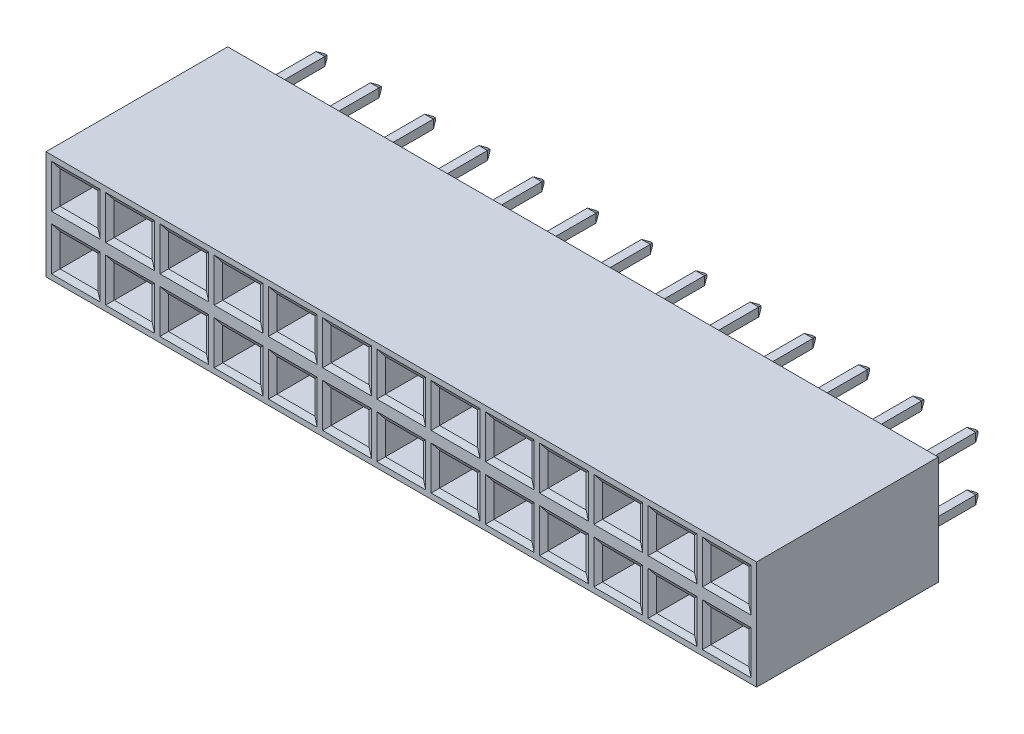
from build123d import *
from OCP.BRepFilletAPI import BRepFilletAPI_MakeChamfer

# Parameters (mm, degrees)
SKETCH1_W                   = 2.794
SKETCH1_H                   = 2.54
BOSS_EXTRUDE1_DEPTH         = 4.2545
SKETCH4_W                   = 1.778
SKETCH4_H                   = 1.524
CUT_EXTRUDE1_DEPTH          = 6.35
CHAMFER2_SIZE               = 0.254
CHAMFER2_SIZE2              = 0.146646968
SKETCH6_W                   = 0.4064
SKETCH6_H                   = 0.4064
BOSS_EXTRUDE2_DEPTH         = 3.2004
CHAMFER3_SIZE               = 0.254
CHAMFER3_SIZE2              = 0.146646968
LPATTERN1_COUNT             = 13
LPATTERN1_PITCH             = 2.54
LPATTERN1_COUNT_DIR2        = 2
LPATTERN1_PITCH_DIR2        = 2.54
CHAMFER2_OF_LPATTERN1_SIZE2 = 0.146646968
CHAMFER2_OF_LPATTERN1_SIZE  = 0.254
CHAMFER3_OF_LPATTERN1_SIZE  = 0.254
CHAMFER3_OF_LPATTERN1_SIZE2 = 0.146646968


with BuildPart() as part:
    # Sketch1 → Boss-Extrude1 (new, symmetric)
    with BuildSketch(Plane.XY):
        Rectangle(SKETCH1_W, SKETCH1_H)
    boss_extrude1 = extrude(amount=BOSS_EXTRUDE1_DEPTH, both=True)

    # Sketch4 → Cut-Extrude1 (cut)
    with BuildSketch(Plane.XY.offset(4.2545)):
        Rectangle(SKETCH4_W, SKETCH4_H)
    cut_extrude1 = extrude(amount=-CUT_EXTRUDE1_DEPTH, mode=Mode.SUBTRACT)

    # Chamfer2
    chamfer2_edges = [part.edges().sort_by_distance(p)[0] for p in [
        (-0.889, 0, 4.2545),
        (0, 0.762, 4.2545),
        (0.889, 0, 4.2545),
        (0, -0.762, 4.2545),
    ]]
    chamfer2_side = [part.faces().sort_by_distance(p)[0] for p in [
        (0, -1.232240185, 4.2545),
    ]]
    chamfer(chamfer2_edges, length=CHAMFER2_SIZE, length2=CHAMFER2_SIZE2, reference=chamfer2_side[0])

    # Sketch6 → Boss-Extrude2 (add)
    with BuildSketch(Plane(origin=(0, 0, -4.2545), x_dir=(-1, 0, 0), z_dir=(0, 0, -1))):
        Rectangle(SKETCH6_W, SKETCH6_H)
    boss_extrude2 = extrude(amount=BOSS_EXTRUDE2_DEPTH)

    # Chamfer3: one chamfer whose edges measure the first distance from different faces: ONE call of the kernel's chamfer builder (chamfer() names one face for all edges)
    chamfer3_edges_1 = [part.edges().sort_by_distance(p)[0] for p in [
        (0, -0.2032, -7.4549),
    ]]
    chamfer3_side_1 = [part.faces().sort_by_distance(p)[0] for p in [
        (0, -0.2032, -5.8547),
    ]]
    chamfer3_edges_2 = [part.edges().sort_by_distance(p)[0] for p in [
        (-0.2032, 0, -7.4549),
    ]]
    chamfer3_side_2 = [part.faces().sort_by_distance(p)[0] for p in [
        (-0.2032, 0, -5.8547),
    ]]
    chamfer3_edges_3 = [part.edges().sort_by_distance(p)[0] for p in [
        (0, 0.2032, -7.4549),
    ]]
    chamfer3_side_3 = [part.faces().sort_by_distance(p)[0] for p in [
        (0, 0.2032, -5.8547),
    ]]
    chamfer3_edges_4 = [part.edges().sort_by_distance(p)[0] for p in [
        (0.2032, 0, -7.4549),
    ]]
    chamfer3_side_4 = [part.faces().sort_by_distance(p)[0] for p in [
        (0.2032, 0, -5.8547),
    ]]
    chamfer3 = BRepFilletAPI_MakeChamfer(part.part.solid().wrapped)
    for e in chamfer3_edges_1:
        chamfer3.Add(CHAMFER3_SIZE, CHAMFER3_SIZE2, e.wrapped, chamfer3_side_1[0].wrapped)  # the first distance lies on this face
    for e in chamfer3_edges_2:
        chamfer3.Add(CHAMFER3_SIZE, CHAMFER3_SIZE2, e.wrapped, chamfer3_side_2[0].wrapped)  # the first distance lies on this face
    for e in chamfer3_edges_3:
        chamfer3.Add(CHAMFER3_SIZE, CHAMFER3_SIZE2, e.wrapped, chamfer3_side_3[0].wrapped)  # the first distance lies on this face
    for e in chamfer3_edges_4:
        chamfer3.Add(CHAMFER3_SIZE, CHAMFER3_SIZE2, e.wrapped, chamfer3_side_4[0].wrapped)  # the first distance lies on this face
    add(Compound.cast(chamfer3.Shape()), mode=Mode.REPLACE)

    # LPattern1: Boss-Extrude1, Cut-Extrude1, Boss-Extrude2 13 × 2
    with Locations(*[(i * LPATTERN1_PITCH, -j * LPATTERN1_PITCH_DIR2, 0) for i in range(LPATTERN1_COUNT) for j in range(LPATTERN1_COUNT_DIR2) if (i, j) != (0, 0)]):
        add(boss_extrude1)
        add(cut_extrude1, mode=Mode.SUBTRACT)
        add(boss_extrude2)

    # Chamfer2 of LPattern1
    chamfer2_of_lpattern1_edges = [part.edges().sort_by_distance(p)[0] for p in [
        (-0.889, -2.54, 4.2545),
        (0, -1.778, 4.2545),
        (0.889, -2.54, 4.2545),
        (0, -3.302, 4.2545),
        (1.651, 0, 4.2545),
        (2.54, 0.762, 4.2545),
        (3.429, 0, 4.2545),
        (2.54, -0.762, 4.2545),
        (1.651, -2.54, 4.2545),
        (2.54, -1.778, 4.2545),
        (3.429, -2.54, 4.2545),
        (2.54, -3.302, 4.2545),
        (4.191, 0, 4.2545),
        (5.08, 0.762, 4.2545),
        (5.969, 0, 4.2545),
        (5.08, -0.762, 4.2545),
        (4.191, -2.54, 4.2545),
        (5.08, -1.778, 4.2545),
        (5.969, -2.54, 4.2545),
        (5.08, -3.302, 4.2545),
        (6.731, 0, 4.2545),
        (7.62, 0.762, 4.2545),
        (8.509, 0, 4.2545),
        (7.62, -0.762, 4.2545),
        (6.731, -2.54, 4.2545),
        (7.62, -1.778, 4.2545),
        (8.509, -2.54, 4.2545),
        (7.62, -3.302, 4.2545),
        (9.271, 0, 4.2545),
        (10.16, 0.762, 4.2545),
        (11.049, 0, 4.2545),
        (10.16, -0.762, 4.2545),
        (9.271, -2.54, 4.2545),
        (10.16, -1.778, 4.2545),
        (11.049, -2.54, 4.2545),
        (10.16, -3.302, 4.2545),
        (11.811, 0, 4.2545),
        (12.7, 0.762, 4.2545),
        (13.589, 0, 4.2545),
        (12.7, -0.762, 4.2545),
        (11.811, -2.54, 4.2545),
        (12.7, -1.778, 4.2545),
        (13.589, -2.54, 4.2545),
        (12.7, -3.302, 4.2545),
        (14.351, 0, 4.2545),
        (15.24, 0.762, 4.2545),
        (16.129, 0, 4.2545),
        (15.24, -0.762, 4.2545),
        (14.351, -2.54, 4.2545),
        (15.24, -1.778, 4.2545),
        (16.129, -2.54, 4.2545),
        (15.24, -3.302, 4.2545),
        (16.891, 0, 4.2545),
        (17.78, 0.762, 4.2545),
        (18.669, 0, 4.2545),
        (17.78, -0.762, 4.2545),
        (16.891, -2.54, 4.2545),
        (17.78, -1.778, 4.2545),
        (18.669, -2.54, 4.2545),
        (17.78, -3.302, 4.2545),
        (19.431, 0, 4.2545),
        (20.32, 0.762, 4.2545),
        (21.209, 0, 4.2545),
        (20.32, -0.762, 4.2545),
        (19.431, -2.54, 4.2545),
        (20.32, -1.778, 4.2545),
        (21.209, -2.54, 4.2545),
        (20.32, -3.302, 4.2545),
        (21.971, 0, 4.2545),
        (22.86, 0.762, 4.2545),
        (23.749, 0, 4.2545),
        (22.86, -0.762, 4.2545),
        (21.971, -2.54, 4.2545),
        (22.86, -1.778, 4.2545),
        (23.749, -2.54, 4.2545),
        (22.86, -3.302, 4.2545),
        (24.511, 0, 4.2545),
        (25.4, 0.762, 4.2545),
        (26.289, 0, 4.2545),
        (25.4, -0.762, 4.2545),
        (24.511, -2.54, 4.2545),
        (25.4, -1.778, 4.2545),
        (26.289, -2.54, 4.2545),
        (25.4, -3.302, 4.2545),
        (27.051, 0, 4.2545),
        (27.94, 0.762, 4.2545),
        (28.829, 0, 4.2545),
        (27.94, -0.762, 4.2545),
        (27.051, -2.54, 4.2545),
        (27.94, -1.778, 4.2545),
        (28.829, -2.54, 4.2545),
        (27.94, -3.302, 4.2545),
        (29.591, 0, 4.2545),
        (30.48, 0.762, 4.2545),
        (31.369, 0, 4.2545),
        (30.48, -0.762, 4.2545),
        (29.591, -2.54, 4.2545),
        (30.48, -1.778, 4.2545),
        (31.369, -2.54, 4.2545),
        (30.48, -3.302, 4.2545),
    ]]
    chamfer(chamfer2_of_lpattern1_edges, length=CHAMFER2_OF_LPATTERN1_SIZE, length2=CHAMFER2_OF_LPATTERN1_SIZE2)

    # Chamfer3 of LPattern1: one chamfer whose edges measure the first distance from different faces: ONE call of the kernel's chamfer builder (chamfer() names one face for all edges)
    chamfer3_of_lpattern1_edges_1 = [part.edges().sort_by_distance(p)[0] for p in [
        (0, -2.7432, -7.4549),
    ]]
    chamfer3_of_lpattern1_side_1 = [part.faces().sort_by_distance(p)[0] for p in [
        (0, -2.7432, -5.8547),
    ]]
    chamfer3_of_lpattern1_edges_2 = [part.edges().sort_by_distance(p)[0] for p in [
        (-0.2032, -2.54, -7.4549),
    ]]
    chamfer3_of_lpattern1_side_2 = [part.faces().sort_by_distance(p)[0] for p in [
        (-0.2032, -2.54, -5.8547),
    ]]
    chamfer3_of_lpattern1_edges_3 = [part.edges().sort_by_distance(p)[0] for p in [
        (0, -2.3368, -7.4549),
    ]]
    chamfer3_of_lpattern1_side_3 = [part.faces().sort_by_distance(p)[0] for p in [
        (0, -2.3368, -5.8547),
    ]]
    chamfer3_of_lpattern1_edges_4 = [part.edges().sort_by_distance(p)[0] for p in [
        (0.2032, -2.54, -7.4549),
    ]]
    chamfer3_of_lpattern1_side_4 = [part.faces().sort_by_distance(p)[0] for p in [
        (0.2032, -2.54, -5.8547),
    ]]
    chamfer3_of_lpattern1_edges_5 = [part.edges().sort_by_distance(p)[0] for p in [
        (2.54, -0.2032, -7.4549),
    ]]
    chamfer3_of_lpattern1_side_5 = [part.faces().sort_by_distance(p)[0] for p in [
        (2.54, -0.2032, -5.8547),
    ]]
    chamfer3_of_lpattern1_edges_6 = [part.edges().sort_by_distance(p)[0] for p in [
        (2.3368, 0, -7.4549),
    ]]
    chamfer3_of_lpattern1_side_6 = [part.faces().sort_by_distance(p)[0] for p in [
        (2.3368, 0, -5.8547),
    ]]
    chamfer3_of_lpattern1_edges_7 = [part.edges().sort_by_distance(p)[0] for p in [
        (2.54, 0.2032, -7.4549),
    ]]
    chamfer3_of_lpattern1_side_7 = [part.faces().sort_by_distance(p)[0] for p in [
        (2.54, 0.2032, -5.8547),
    ]]
    chamfer3_of_lpattern1_edges_8 = [part.edges().sort_by_distance(p)[0] for p in [
        (2.7432, 0, -7.4549),
    ]]
    chamfer3_of_lpattern1_side_8 = [part.faces().sort_by_distance(p)[0] for p in [
        (2.7432, 0, -5.8547),
    ]]
    chamfer3_of_lpattern1_edges_9 = [part.edges().sort_by_distance(p)[0] for p in [
        (2.54, -2.7432, -7.4549),
    ]]
    chamfer3_of_lpattern1_side_9 = [part.faces().sort_by_distance(p)[0] for p in [
        (2.54, -2.7432, -5.8547),
    ]]
    chamfer3_of_lpattern1_edges_10 = [part.edges().sort_by_distance(p)[0] for p in [
        (2.3368, -2.54, -7.4549),
    ]]
    chamfer3_of_lpattern1_side_10 = [part.faces().sort_by_distance(p)[0] for p in [
        (2.3368, -2.54, -5.8547),
    ]]
    chamfer3_of_lpattern1_edges_11 = [part.edges().sort_by_distance(p)[0] for p in [
        (2.54, -2.3368, -7.4549),
    ]]
    chamfer3_of_lpattern1_side_11 = [part.faces().sort_by_distance(p)[0] for p in [
        (2.54, -2.3368, -5.8547),
    ]]
    chamfer3_of_lpattern1_edges_12 = [part.edges().sort_by_distance(p)[0] for p in [
        (2.7432, -2.54, -7.4549),
    ]]
    chamfer3_of_lpattern1_side_12 = [part.faces().sort_by_distance(p)[0] for p in [
        (2.7432, -2.54, -5.8547),
    ]]
    chamfer3_of_lpattern1_edges_13 = [part.edges().sort_by_distance(p)[0] for p in [
        (5.08, -0.2032, -7.4549),
    ]]
    chamfer3_of_lpattern1_side_13 = [part.faces().sort_by_distance(p)[0] for p in [
        (5.08, -0.2032, -5.8547),
    ]]
    chamfer3_of_lpattern1_edges_14 = [part.edges().sort_by_distance(p)[0] for p in [
        (4.8768, 0, -7.4549),
    ]]
    chamfer3_of_lpattern1_side_14 = [part.faces().sort_by_distance(p)[0] for p in [
        (4.8768, 0, -5.8547),
    ]]
    chamfer3_of_lpattern1_edges_15 = [part.edges().sort_by_distance(p)[0] for p in [
        (5.08, 0.2032, -7.4549),
    ]]
    chamfer3_of_lpattern1_side_15 = [part.faces().sort_by_distance(p)[0] for p in [
        (5.08, 0.2032, -5.8547),
    ]]
    chamfer3_of_lpattern1_edges_16 = [part.edges().sort_by_distance(p)[0] for p in [
        (5.2832, 0, -7.4549),
    ]]
    chamfer3_of_lpattern1_side_16 = [part.faces().sort_by_distance(p)[0] for p in [
        (5.2832, 0, -5.8547),
    ]]
    chamfer3_of_lpattern1_edges_17 = [part.edges().sort_by_distance(p)[0] for p in [
        (5.08, -2.7432, -7.4549),
    ]]
    chamfer3_of_lpattern1_side_17 = [part.faces().sort_by_distance(p)[0] for p in [
        (5.08, -2.7432, -5.8547),
    ]]
    chamfer3_of_lpattern1_edges_18 = [part.edges().sort_by_distance(p)[0] for p in [
        (4.8768, -2.54, -7.4549),
    ]]
    chamfer3_of_lpattern1_side_18 = [part.faces().sort_by_distance(p)[0] for p in [
        (4.8768, -2.54, -5.8547),
    ]]
    chamfer3_of_lpattern1_edges_19 = [part.edges().sort_by_distance(p)[0] for p in [
        (5.08, -2.3368, -7.4549),
    ]]
    chamfer3_of_lpattern1_side_19 = [part.faces().sort_by_distance(p)[0] for p in [
        (5.08, -2.3368, -5.8547),
    ]]
    chamfer3_of_lpattern1_edges_20 = [part.edges().sort_by_distance(p)[0] for p in [
        (5.2832, -2.54, -7.4549),
    ]]
    chamfer3_of_lpattern1_side_20 = [part.faces().sort_by_distance(p)[0] for p in [
        (5.2832, -2.54, -5.8547),
    ]]
    chamfer3_of_lpattern1_edges_21 = [part.edges().sort_by_distance(p)[0] for p in [
        (7.62, -0.2032, -7.4549),
    ]]
    chamfer3_of_lpattern1_side_21 = [part.faces().sort_by_distance(p)[0] for p in [
        (7.62, -0.2032, -5.8547),
    ]]
    chamfer3_of_lpattern1_edges_22 = [part.edges().sort_by_distance(p)[0] for p in [
        (7.4168, 0, -7.4549),
    ]]
    chamfer3_of_lpattern1_side_22 = [part.faces().sort_by_distance(p)[0] for p in [
        (7.4168, 0, -5.8547),
    ]]
    chamfer3_of_lpattern1_edges_23 = [part.edges().sort_by_distance(p)[0] for p in [
        (7.62, 0.2032, -7.4549),
    ]]
    chamfer3_of_lpattern1_side_23 = [part.faces().sort_by_distance(p)[0] for p in [
        (7.62, 0.2032, -5.8547),
    ]]
    chamfer3_of_lpattern1_edges_24 = [part.edges().sort_by_distance(p)[0] for p in [
        (7.8232, 0, -7.4549),
    ]]
    chamfer3_of_lpattern1_side_24 = [part.faces().sort_by_distance(p)[0] for p in [
        (7.8232, 0, -5.8547),
    ]]
    chamfer3_of_lpattern1_edges_25 = [part.edges().sort_by_distance(p)[0] for p in [
        (7.62, -2.7432, -7.4549),
    ]]
    chamfer3_of_lpattern1_side_25 = [part.faces().sort_by_distance(p)[0] for p in [
        (7.62, -2.7432, -5.8547),
    ]]
    chamfer3_of_lpattern1_edges_26 = [part.edges().sort_by_distance(p)[0] for p in [
        (7.4168, -2.54, -7.4549),
    ]]
    chamfer3_of_lpattern1_side_26 = [part.faces().sort_by_distance(p)[0] for p in [
        (7.4168, -2.54, -5.8547),
    ]]
    chamfer3_of_lpattern1_edges_27 = [part.edges().sort_by_distance(p)[0] for p in [
        (7.62, -2.3368, -7.4549),
    ]]
    chamfer3_of_lpattern1_side_27 = [part.faces().sort_by_distance(p)[0] for p in [
        (7.62, -2.3368, -5.8547),
    ]]
    chamfer3_of_lpattern1_edges_28 = [part.edges().sort_by_distance(p)[0] for p in [
        (7.8232, -2.54, -7.4549),
    ]]
    chamfer3_of_lpattern1_side_28 = [part.faces().sort_by_distance(p)[0] for p in [
        (7.8232, -2.54, -5.8547),
    ]]
    chamfer3_of_lpattern1_edges_29 = [part.edges().sort_by_distance(p)[0] for p in [
        (10.16, -0.2032, -7.4549),
    ]]
    chamfer3_of_lpattern1_side_29 = [part.faces().sort_by_distance(p)[0] for p in [
        (10.16, -0.2032, -5.8547),
    ]]
    chamfer3_of_lpattern1_edges_30 = [part.edges().sort_by_distance(p)[0] for p in [
        (9.9568, 0, -7.4549),
    ]]
    chamfer3_of_lpattern1_side_30 = [part.faces().sort_by_distance(p)[0] for p in [
        (9.9568, 0, -5.8547),
    ]]
    chamfer3_of_lpattern1_edges_31 = [part.edges().sort_by_distance(p)[0] for p in [
        (10.16, 0.2032, -7.4549),
    ]]
    chamfer3_of_lpattern1_side_31 = [part.faces().sort_by_distance(p)[0] for p in [
        (10.16, 0.2032, -5.8547),
    ]]
    chamfer3_of_lpattern1_edges_32 = [part.edges().sort_by_distance(p)[0] for p in [
        (10.3632, 0, -7.4549),
    ]]
    chamfer3_of_lpattern1_side_32 = [part.faces().sort_by_distance(p)[0] for p in [
        (10.3632, 0, -5.8547),
    ]]
    chamfer3_of_lpattern1_edges_33 = [part.edges().sort_by_distance(p)[0] for p in [
        (10.16, -2.7432, -7.4549),
    ]]
    chamfer3_of_lpattern1_side_33 = [part.faces().sort_by_distance(p)[0] for p in [
        (10.16, -2.7432, -5.8547),
    ]]
    chamfer3_of_lpattern1_edges_34 = [part.edges().sort_by_distance(p)[0] for p in [
        (9.9568, -2.54, -7.4549),
    ]]
    chamfer3_of_lpattern1_side_34 = [part.faces().sort_by_distance(p)[0] for p in [
        (9.9568, -2.54, -5.8547),
    ]]
    chamfer3_of_lpattern1_edges_35 = [part.edges().sort_by_distance(p)[0] for p in [
        (10.16, -2.3368, -7.4549),
    ]]
    chamfer3_of_lpattern1_side_35 = [part.faces().sort_by_distance(p)[0] for p in [
        (10.16, -2.3368, -5.8547),
    ]]
    chamfer3_of_lpattern1_edges_36 = [part.edges().sort_by_distance(p)[0] for p in [
        (10.3632, -2.54, -7.4549),
    ]]
    chamfer3_of_lpattern1_side_36 = [part.faces().sort_by_distance(p)[0] for p in [
        (10.3632, -2.54, -5.8547),
    ]]
    chamfer3_of_lpattern1_edges_37 = [part.edges().sort_by_distance(p)[0] for p in [
        (12.7, -0.2032, -7.4549),
    ]]
    chamfer3_of_lpattern1_side_37 = [part.faces().sort_by_distance(p)[0] for p in [
        (12.7, -0.2032, -5.8547),
    ]]
    chamfer3_of_lpattern1_edges_38 = [part.edges().sort_by_distance(p)[0] for p in [
        (12.4968, 0, -7.4549),
    ]]
    chamfer3_of_lpattern1_side_38 = [part.faces().sort_by_distance(p)[0] for p in [
        (12.4968, 0, -5.8547),
    ]]
    chamfer3_of_lpattern1_edges_39 = [part.edges().sort_by_distance(p)[0] for p in [
        (12.7, 0.2032, -7.4549),
    ]]
    chamfer3_of_lpattern1_side_39 = [part.faces().sort_by_distance(p)[0] for p in [
        (12.7, 0.2032, -5.8547),
    ]]
    chamfer3_of_lpattern1_edges_40 = [part.edges().sort_by_distance(p)[0] for p in [
        (12.9032, 0, -7.4549),
    ]]
    chamfer3_of_lpattern1_side_40 = [part.faces().sort_by_distance(p)[0] for p in [
        (12.9032, 0, -5.8547),
    ]]
    chamfer3_of_lpattern1_edges_41 = [part.edges().sort_by_distance(p)[0] for p in [
        (12.7, -2.7432, -7.4549),
    ]]
    chamfer3_of_lpattern1_side_41 = [part.faces().sort_by_distance(p)[0] for p in [
        (12.7, -2.7432, -5.8547),
    ]]
    chamfer3_of_lpattern1_edges_42 = [part.edges().sort_by_distance(p)[0] for p in [
        (12.4968, -2.54, -7.4549),
    ]]
    chamfer3_of_lpattern1_side_42 = [part.faces().sort_by_distance(p)[0] for p in [
        (12.4968, -2.54, -5.8547),
    ]]
    chamfer3_of_lpattern1_edges_43 = [part.edges().sort_by_distance(p)[0] for p in [
        (12.7, -2.3368, -7.4549),
    ]]
    chamfer3_of_lpattern1_side_43 = [part.faces().sort_by_distance(p)[0] for p in [
        (12.7, -2.3368, -5.8547),
    ]]
    chamfer3_of_lpattern1_edges_44 = [part.edges().sort_by_distance(p)[0] for p in [
        (12.9032, -2.54, -7.4549),
    ]]
    chamfer3_of_lpattern1_side_44 = [part.faces().sort_by_distance(p)[0] for p in [
        (12.9032, -2.54, -5.8547),
    ]]
    chamfer3_of_lpattern1_edges_45 = [part.edges().sort_by_distance(p)[0] for p in [
        (15.24, -0.2032, -7.4549),
    ]]
    chamfer3_of_lpattern1_side_45 = [part.faces().sort_by_distance(p)[0] for p in [
        (15.24, -0.2032, -5.8547),
    ]]
    chamfer3_of_lpattern1_edges_46 = [part.edges().sort_by_distance(p)[0] for p in [
        (15.0368, 0, -7.4549),
    ]]
    chamfer3_of_lpattern1_side_46 = [part.faces().sort_by_distance(p)[0] for p in [
        (15.0368, 0, -5.8547),
    ]]
    chamfer3_of_lpattern1_edges_47 = [part.edges().sort_by_distance(p)[0] for p in [
        (15.24, 0.2032, -7.4549),
    ]]
    chamfer3_of_lpattern1_side_47 = [part.faces().sort_by_distance(p)[0] for p in [
        (15.24, 0.2032, -5.8547),
    ]]
    chamfer3_of_lpattern1_edges_48 = [part.edges().sort_by_distance(p)[0] for p in [
        (15.4432, 0, -7.4549),
    ]]
    chamfer3_of_lpattern1_side_48 = [part.faces().sort_by_distance(p)[0] for p in [
        (15.4432, 0, -5.8547),
    ]]
    chamfer3_of_lpattern1_edges_49 = [part.edges().sort_by_distance(p)[0] for p in [
        (15.24, -2.7432, -7.4549),
    ]]
    chamfer3_of_lpattern1_side_49 = [part.faces().sort_by_distance(p)[0] for p in [
        (15.24, -2.7432, -5.8547),
    ]]
    chamfer3_of_lpattern1_edges_50 = [part.edges().sort_by_distance(p)[0] for p in [
        (15.0368, -2.54, -7.4549),
    ]]
    chamfer3_of_lpattern1_side_50 = [part.faces().sort_by_distance(p)[0] for p in [
        (15.0368, -2.54, -5.8547),
    ]]
    chamfer3_of_lpattern1_edges_51 = [part.edges().sort_by_distance(p)[0] for p in [
        (15.24, -2.3368, -7.4549),
    ]]
    chamfer3_of_lpattern1_side_51 = [part.faces().sort_by_distance(p)[0] for p in [
        (15.24, -2.3368, -5.8547),
    ]]
    chamfer3_of_lpattern1_edges_52 = [part.edges().sort_by_distance(p)[0] for p in [
        (15.4432, -2.54, -7.4549),
    ]]
    chamfer3_of_lpattern1_side_52 = [part.faces().sort_by_distance(p)[0] for p in [
        (15.4432, -2.54, -5.8547),
    ]]
    chamfer3_of_lpattern1_edges_53 = [part.edges().sort_by_distance(p)[0] for p in [
        (17.78, -0.2032, -7.4549),
    ]]
    chamfer3_of_lpattern1_side_53 = [part.faces().sort_by_distance(p)[0] for p in [
        (17.78, -0.2032, -5.8547),
    ]]
    chamfer3_of_lpattern1_edges_54 = [part.edges().sort_by_distance(p)[0] for p in [
        (17.5768, 0, -7.4549),
    ]]
    chamfer3_of_lpattern1_side_54 = [part.faces().sort_by_distance(p)[0] for p in [
        (17.5768, 0, -5.8547),
    ]]
    chamfer3_of_lpattern1_edges_55 = [part.edges().sort_by_distance(p)[0] for p in [
        (17.78, 0.2032, -7.4549),
    ]]
    chamfer3_of_lpattern1_side_55 = [part.faces().sort_by_distance(p)[0] for p in [
        (17.78, 0.2032, -5.8547),
    ]]
    chamfer3_of_lpattern1_edges_56 = [part.edges().sort_by_distance(p)[0] for p in [
        (17.9832, 0, -7.4549),
    ]]
    chamfer3_of_lpattern1_side_56 = [part.faces().sort_by_distance(p)[0] for p in [
        (17.9832, 0, -5.8547),
    ]]
    chamfer3_of_lpattern1_edges_57 = [part.edges().sort_by_distance(p)[0] for p in [
        (17.78, -2.7432, -7.4549),
    ]]
    chamfer3_of_lpattern1_side_57 = [part.faces().sort_by_distance(p)[0] for p in [
        (17.78, -2.7432, -5.8547),
    ]]
    chamfer3_of_lpattern1_edges_58 = [part.edges().sort_by_distance(p)[0] for p in [
        (17.5768, -2.54, -7.4549),
    ]]
    chamfer3_of_lpattern1_side_58 = [part.faces().sort_by_distance(p)[0] for p in [
        (17.5768, -2.54, -5.8547),
    ]]
    chamfer3_of_lpattern1_edges_59 = [part.edges().sort_by_distance(p)[0] for p in [
        (17.78, -2.3368, -7.4549),
    ]]
    chamfer3_of_lpattern1_side_59 = [part.faces().sort_by_distance(p)[0] for p in [
        (17.78, -2.3368, -5.8547),
    ]]
    chamfer3_of_lpattern1_edges_60 = [part.edges().sort_by_distance(p)[0] for p in [
        (17.9832, -2.54, -7.4549),
    ]]
    chamfer3_of_lpattern1_side_60 = [part.faces().sort_by_distance(p)[0] for p in [
        (17.9832, -2.54, -5.8547),
    ]]
    chamfer3_of_lpattern1_edges_61 = [part.edges().sort_by_distance(p)[0] for p in [
        (20.32, -0.2032, -7.4549),
    ]]
    chamfer3_of_lpattern1_side_61 = [part.faces().sort_by_distance(p)[0] for p in [
        (20.32, -0.2032, -5.8547),
    ]]
    chamfer3_of_lpattern1_edges_62 = [part.edges().sort_by_distance(p)[0] for p in [
        (20.1168, 0, -7.4549),
    ]]
    chamfer3_of_lpattern1_side_62 = [part.faces().sort_by_distance(p)[0] for p in [
        (20.1168, 0, -5.8547),
    ]]
    chamfer3_of_lpattern1_edges_63 = [part.edges().sort_by_distance(p)[0] for p in [
        (20.32, 0.2032, -7.4549),
    ]]
    chamfer3_of_lpattern1_side_63 = [part.faces().sort_by_distance(p)[0] for p in [
        (20.32, 0.2032, -5.8547),
    ]]
    chamfer3_of_lpattern1_edges_64 = [part.edges().sort_by_distance(p)[0] for p in [
        (20.5232, 0, -7.4549),
    ]]
    chamfer3_of_lpattern1_side_64 = [part.faces().sort_by_distance(p)[0] for p in [
        (20.5232, 0, -5.8547),
    ]]
    chamfer3_of_lpattern1_edges_65 = [part.edges().sort_by_distance(p)[0] for p in [
        (20.32, -2.7432, -7.4549),
    ]]
    chamfer3_of_lpattern1_side_65 = [part.faces().sort_by_distance(p)[0] for p in [
        (20.32, -2.7432, -5.8547),
    ]]
    chamfer3_of_lpattern1_edges_66 = [part.edges().sort_by_distance(p)[0] for p in [
        (20.1168, -2.54, -7.4549),
    ]]
    chamfer3_of_lpattern1_side_66 = [part.faces().sort_by_distance(p)[0] for p in [
        (20.1168, -2.54, -5.8547),
    ]]
    chamfer3_of_lpattern1_edges_67 = [part.edges().sort_by_distance(p)[0] for p in [
        (20.32, -2.3368, -7.4549),
    ]]
    chamfer3_of_lpattern1_side_67 = [part.faces().sort_by_distance(p)[0] for p in [
        (20.32, -2.3368, -5.8547),
    ]]
    chamfer3_of_lpattern1_edges_68 = [part.edges().sort_by_distance(p)[0] for p in [
        (20.5232, -2.54, -7.4549),
    ]]
    chamfer3_of_lpattern1_side_68 = [part.faces().sort_by_distance(p)[0] for p in [
        (20.5232, -2.54, -5.8547),
    ]]
    chamfer3_of_lpattern1_edges_69 = [part.edges().sort_by_distance(p)[0] for p in [
        (22.86, -0.2032, -7.4549),
    ]]
    chamfer3_of_lpattern1_side_69 = [part.faces().sort_by_distance(p)[0] for p in [
        (22.86, -0.2032, -5.8547),
    ]]
    chamfer3_of_lpattern1_edges_70 = [part.edges().sort_by_distance(p)[0] for p in [
        (22.6568, 0, -7.4549),
    ]]
    chamfer3_of_lpattern1_side_70 = [part.faces().sort_by_distance(p)[0] for p in [
        (22.6568, 0, -5.8547),
    ]]
    chamfer3_of_lpattern1_edges_71 = [part.edges().sort_by_distance(p)[0] for p in [
        (22.86, 0.2032, -7.4549),
    ]]
    chamfer3_of_lpattern1_side_71 = [part.faces().sort_by_distance(p)[0] for p in [
        (22.86, 0.2032, -5.8547),
    ]]
    chamfer3_of_lpattern1_edges_72 = [part.edges().sort_by_distance(p)[0] for p in [
        (23.0632, 0, -7.4549),
    ]]
    chamfer3_of_lpattern1_side_72 = [part.faces().sort_by_distance(p)[0] for p in [
        (23.0632, 0, -5.8547),
    ]]
    chamfer3_of_lpattern1_edges_73 = [part.edges().sort_by_distance(p)[0] for p in [
        (22.86, -2.7432, -7.4549),
    ]]
    chamfer3_of_lpattern1_side_73 = [part.faces().sort_by_distance(p)[0] for p in [
        (22.86, -2.7432, -5.8547),
    ]]
    chamfer3_of_lpattern1_edges_74 = [part.edges().sort_by_distance(p)[0] for p in [
        (22.6568, -2.54, -7.4549),
    ]]
    chamfer3_of_lpattern1_side_74 = [part.faces().sort_by_distance(p)[0] for p in [
        (22.6568, -2.54, -5.8547),
    ]]
    chamfer3_of_lpattern1_edges_75 = [part.edges().sort_by_distance(p)[0] for p in [
        (22.86, -2.3368, -7.4549),
    ]]
    chamfer3_of_lpattern1_side_75 = [part.faces().sort_by_distance(p)[0] for p in [
        (22.86, -2.3368, -5.8547),
    ]]
    chamfer3_of_lpattern1_edges_76 = [part.edges().sort_by_distance(p)[0] for p in [
        (23.0632, -2.54, -7.4549),
    ]]
    chamfer3_of_lpattern1_side_76 = [part.faces().sort_by_distance(p)[0] for p in [
        (23.0632, -2.54, -5.8547),
    ]]
    chamfer3_of_lpattern1_edges_77 = [part.edges().sort_by_distance(p)[0] for p in [
        (25.4, -0.2032, -7.4549),
    ]]
    chamfer3_of_lpattern1_side_77 = [part.faces().sort_by_distance(p)[0] for p in [
        (25.4, -0.2032, -5.8547),
    ]]
    chamfer3_of_lpattern1_edges_78 = [part.edges().sort_by_distance(p)[0] for p in [
        (25.1968, 0, -7.4549),
    ]]
    chamfer3_of_lpattern1_side_78 = [part.faces().sort_by_distance(p)[0] for p in [
        (25.1968, 0, -5.8547),
    ]]
    chamfer3_of_lpattern1_edges_79 = [part.edges().sort_by_distance(p)[0] for p in [
        (25.4, 0.2032, -7.4549),
    ]]
    chamfer3_of_lpattern1_side_79 = [part.faces().sort_by_distance(p)[0] for p in [
        (25.4, 0.2032, -5.8547),
    ]]
    chamfer3_of_lpattern1_edges_80 = [part.edges().sort_by_distance(p)[0] for p in [
        (25.6032, 0, -7.4549),
    ]]
    chamfer3_of_lpattern1_side_80 = [part.faces().sort_by_distance(p)[0] for p in [
        (25.6032, 0, -5.8547),
    ]]
    chamfer3_of_lpattern1_edges_81 = [part.edges().sort_by_distance(p)[0] for p in [
        (25.4, -2.7432, -7.4549),
    ]]
    chamfer3_of_lpattern1_side_81 = [part.faces().sort_by_distance(p)[0] for p in [
        (25.4, -2.7432, -5.8547),
    ]]
    chamfer3_of_lpattern1_edges_82 = [part.edges().sort_by_distance(p)[0] for p in [
        (25.1968, -2.54, -7.4549),
    ]]
    chamfer3_of_lpattern1_side_82 = [part.faces().sort_by_distance(p)[0] for p in [
        (25.1968, -2.54, -5.8547),
    ]]
    chamfer3_of_lpattern1_edges_83 = [part.edges().sort_by_distance(p)[0] for p in [
        (25.4, -2.3368, -7.4549),
    ]]
    chamfer3_of_lpattern1_side_83 = [part.faces().sort_by_distance(p)[0] for p in [
        (25.4, -2.3368, -5.8547),
    ]]
    chamfer3_of_lpattern1_edges_84 = [part.edges().sort_by_distance(p)[0] for p in [
        (25.6032, -2.54, -7.4549),
    ]]
    chamfer3_of_lpattern1_side_84 = [part.faces().sort_by_distance(p)[0] for p in [
        (25.6032, -2.54, -5.8547),
    ]]
    chamfer3_of_lpattern1_edges_85 = [part.edges().sort_by_distance(p)[0] for p in [
        (27.94, -0.2032, -7.4549),
    ]]
    chamfer3_of_lpattern1_side_85 = [part.faces().sort_by_distance(p)[0] for p in [
        (27.94, -0.2032, -5.8547),
    ]]
    chamfer3_of_lpattern1_edges_86 = [part.edges().sort_by_distance(p)[0] for p in [
        (27.7368, 0, -7.4549),
    ]]
    chamfer3_of_lpattern1_side_86 = [part.faces().sort_by_distance(p)[0] for p in [
        (27.7368, 0, -5.8547),
    ]]
    chamfer3_of_lpattern1_edges_87 = [part.edges().sort_by_distance(p)[0] for p in [
        (27.94, 0.2032, -7.4549),
    ]]
    chamfer3_of_lpattern1_side_87 = [part.faces().sort_by_distance(p)[0] for p in [
        (27.94, 0.2032, -5.8547),
    ]]
    chamfer3_of_lpattern1_edges_88 = [part.edges().sort_by_distance(p)[0] for p in [
        (28.1432, 0, -7.4549),
    ]]
    chamfer3_of_lpattern1_side_88 = [part.faces().sort_by_distance(p)[0] for p in [
        (28.1432, 0, -5.8547),
    ]]
    chamfer3_of_lpattern1_edges_89 = [part.edges().sort_by_distance(p)[0] for p in [
        (27.94, -2.7432, -7.4549),
    ]]
    chamfer3_of_lpattern1_side_89 = [part.faces().sort_by_distance(p)[0] for p in [
        (27.94, -2.7432, -5.8547),
    ]]
    chamfer3_of_lpattern1_edges_90 = [part.edges().sort_by_distance(p)[0] for p in [
        (27.7368, -2.54, -7.4549),
    ]]
    chamfer3_of_lpattern1_side_90 = [part.faces().sort_by_distance(p)[0] for p in [
        (27.7368, -2.54, -5.8547),
    ]]
    chamfer3_of_lpattern1_edges_91 = [part.edges().sort_by_distance(p)[0] for p in [
        (27.94, -2.3368, -7.4549),
    ]]
    chamfer3_of_lpattern1_side_91 = [part.faces().sort_by_distance(p)[0] for p in [
        (27.94, -2.3368, -5.8547),
    ]]
    chamfer3_of_lpattern1_edges_92 = [part.edges().sort_by_distance(p)[0] for p in [
        (28.1432, -2.54, -7.4549),
    ]]
    chamfer3_of_lpattern1_side_92 = [part.faces().sort_by_distance(p)[0] for p in [
        (28.1432, -2.54, -5.8547),
    ]]
    chamfer3_of_lpattern1_edges_93 = [part.edges().sort_by_distance(p)[0] for p in [
        (30.48, -0.2032, -7.4549),
    ]]
    chamfer3_of_lpattern1_side_93 = [part.faces().sort_by_distance(p)[0] for p in [
        (30.48, -0.2032, -5.8547),
    ]]
    chamfer3_of_lpattern1_edges_94 = [part.edges().sort_by_distance(p)[0] for p in [
        (30.2768, 0, -7.4549),
    ]]
    chamfer3_of_lpattern1_side_94 = [part.faces().sort_by_distance(p)[0] for p in [
        (30.2768, 0, -5.8547),
    ]]
    chamfer3_of_lpattern1_edges_95 = [part.edges().sort_by_distance(p)[0] for p in [
        (30.48, 0.2032, -7.4549),
    ]]
    chamfer3_of_lpattern1_side_95 = [part.faces().sort_by_distance(p)[0] for p in [
        (30.48, 0.2032, -5.8547),
    ]]
    chamfer3_of_lpattern1_edges_96 = [part.edges().sort_by_distance(p)[0] for p in [
        (30.6832, 0, -7.4549),
    ]]
    chamfer3_of_lpattern1_side_96 = [part.faces().sort_by_distance(p)[0] for p in [
        (30.6832, 0, -5.8547),
    ]]
    chamfer3_of_lpattern1_edges_97 = [part.edges().sort_by_distance(p)[0] for p in [
        (30.48, -2.7432, -7.4549),
    ]]
    chamfer3_of_lpattern1_side_97 = [part.faces().sort_by_distance(p)[0] for p in [
        (30.48, -2.7432, -5.8547),
    ]]
    chamfer3_of_lpattern1_edges_98 = [part.edges().sort_by_distance(p)[0] for p in [
        (30.2768, -2.54, -7.4549),
    ]]
    chamfer3_of_lpattern1_side_98 = [part.faces().sort_by_distance(p)[0] for p in [
        (30.2768, -2.54, -5.8547),
    ]]
    chamfer3_of_lpattern1_edges_99 = [part.edges().sort_by_distance(p)[0] for p in [
        (30.48, -2.3368, -7.4549),
    ]]
    chamfer3_of_lpattern1_side_99 = [part.faces().sort_by_distance(p)[0] for p in [
        (30.48, -2.3368, -5.8547),
    ]]
    chamfer3_of_lpattern1_edges_100 = [part.edges().sort_by_distance(p)[0] for p in [
        (30.6832, -2.54, -7.4549),
    ]]
    chamfer3_of_lpattern1_side_100 = [part.faces().sort_by_distance(p)[0] for p in [
        (30.6832, -2.54, -5.8547),
    ]]
    chamfer3_of_lpattern1 = BRepFilletAPI_MakeChamfer(part.part.solid().wrapped)
    for e in chamfer3_of_lpattern1_edges_1:
        chamfer3_of_lpattern1.Add(CHAMFER3_OF_LPATTERN1_SIZE, CHAMFER3_OF_LPATTERN1_SIZE2, e.wrapped, chamfer3_of_lpattern1_side_1[0].wrapped)  # the first distance lies on this face
    for e in chamfer3_of_lpattern1_edges_2:
        chamfer3_of_lpattern1.Add(CHAMFER3_OF_LPATTERN1_SIZE, CHAMFER3_OF_LPATTERN1_SIZE2, e.wrapped, chamfer3_of_lpattern1_side_2[0].wrapped)  # the first distance lies on this face
    for e in chamfer3_of_lpattern1_edges_3:
        chamfer3_of_lpattern1.Add(CHAMFER3_OF_LPATTERN1_SIZE, CHAMFER3_OF_LPATTERN1_SIZE2, e.wrapped, chamfer3_of_lpattern1_side_3[0].wrapped)  # the first distance lies on this face
    for e in chamfer3_of_lpattern1_edges_4:
        chamfer3_of_lpattern1.Add(CHAMFER3_OF_LPATTERN1_SIZE, CHAMFER3_OF_LPATTERN1_SIZE2, e.wrapped, chamfer3_of_lpattern1_side_4[0].wrapped)  # the first distance lies on this face
    for e in chamfer3_of_lpattern1_edges_5:
        chamfer3_of_lpattern1.Add(CHAMFER3_OF_LPATTERN1_SIZE, CHAMFER3_OF_LPATTERN1_SIZE2, e.wrapped, chamfer3_of_lpattern1_side_5[0].wrapped)  # the first distance lies on this face
    for e in chamfer3_of_lpattern1_edges_6:
        chamfer3_of_lpattern1.Add(CHAMFER3_OF_LPATTERN1_SIZE, CHAMFER3_OF_LPATTERN1_SIZE2, e.wrapped, chamfer3_of_lpattern1_side_6[0].wrapped)  # the first distance lies on this face
    for e in chamfer3_of_lpattern1_edges_7:
        chamfer3_of_lpattern1.Add(CHAMFER3_OF_LPATTERN1_SIZE, CHAMFER3_OF_LPATTERN1_SIZE2, e.wrapped, chamfer3_of_lpattern1_side_7[0].wrapped)  # the first distance lies on this face
    for e in chamfer3_of_lpattern1_edges_8:
        chamfer3_of_lpattern1.Add(CHAMFER3_OF_LPATTERN1_SIZE, CHAMFER3_OF_LPATTERN1_SIZE2, e.wrapped, chamfer3_of_lpattern1_side_8[0].wrapped)  # the first distance lies on this face
    for e in chamfer3_of_lpattern1_edges_9:
        chamfer3_of_lpattern1.Add(CHAMFER3_OF_LPATTERN1_SIZE, CHAMFER3_OF_LPATTERN1_SIZE2, e.wrapped, chamfer3_of_lpattern1_side_9[0].wrapped)  # the first distance lies on this face
    for e in chamfer3_of_lpattern1_edges_10:
        chamfer3_of_lpattern1.Add(CHAMFER3_OF_LPATTERN1_SIZE, CHAMFER3_OF_LPATTERN1_SIZE2, e.wrapped, chamfer3_of_lpattern1_side_10[0].wrapped)  # the first distance lies on this face
    for e in chamfer3_of_lpattern1_edges_11:
        chamfer3_of_lpattern1.Add(CHAMFER3_OF_LPATTERN1_SIZE, CHAMFER3_OF_LPATTERN1_SIZE2, e.wrapped, chamfer3_of_lpattern1_side_11[0].wrapped)  # the first distance lies on this face
    for e in chamfer3_of_lpattern1_edges_12:
        chamfer3_of_lpattern1.Add(CHAMFER3_OF_LPATTERN1_SIZE, CHAMFER3_OF_LPATTERN1_SIZE2, e.wrapped, chamfer3_of_lpattern1_side_12[0].wrapped)  # the first distance lies on this face
    for e in chamfer3_of_lpattern1_edges_13:
        chamfer3_of_lpattern1.Add(CHAMFER3_OF_LPATTERN1_SIZE, CHAMFER3_OF_LPATTERN1_SIZE2, e.wrapped, chamfer3_of_lpattern1_side_13[0].wrapped)  # the first distance lies on this face
    for e in chamfer3_of_lpattern1_edges_14:
        chamfer3_of_lpattern1.Add(CHAMFER3_OF_LPATTERN1_SIZE, CHAMFER3_OF_LPATTERN1_SIZE2, e.wrapped, chamfer3_of_lpattern1_side_14[0].wrapped)  # the first distance lies on this face
    for e in chamfer3_of_lpattern1_edges_15:
        chamfer3_of_lpattern1.Add(CHAMFER3_OF_LPATTERN1_SIZE, CHAMFER3_OF_LPATTERN1_SIZE2, e.wrapped, chamfer3_of_lpattern1_side_15[0].wrapped)  # the first distance lies on this face
    for e in chamfer3_of_lpattern1_edges_16:
        chamfer3_of_lpattern1.Add(CHAMFER3_OF_LPATTERN1_SIZE, CHAMFER3_OF_LPATTERN1_SIZE2, e.wrapped, chamfer3_of_lpattern1_side_16[0].wrapped)  # the first distance lies on this face
    for e in chamfer3_of_lpattern1_edges_17:
        chamfer3_of_lpattern1.Add(CHAMFER3_OF_LPATTERN1_SIZE, CHAMFER3_OF_LPATTERN1_SIZE2, e.wrapped, chamfer3_of_lpattern1_side_17[0].wrapped)  # the first distance lies on this face
    for e in chamfer3_of_lpattern1_edges_18:
        chamfer3_of_lpattern1.Add(CHAMFER3_OF_LPATTERN1_SIZE, CHAMFER3_OF_LPATTERN1_SIZE2, e.wrapped, chamfer3_of_lpattern1_side_18[0].wrapped)  # the first distance lies on this face
    for e in chamfer3_of_lpattern1_edges_19:
        chamfer3_of_lpattern1.Add(CHAMFER3_OF_LPATTERN1_SIZE, CHAMFER3_OF_LPATTERN1_SIZE2, e.wrapped, chamfer3_of_lpattern1_side_19[0].wrapped)  # the first distance lies on this face
    for e in chamfer3_of_lpattern1_edges_20:
        chamfer3_of_lpattern1.Add(CHAMFER3_OF_LPATTERN1_SIZE, CHAMFER3_OF_LPATTERN1_SIZE2, e.wrapped, chamfer3_of_lpattern1_side_20[0].wrapped)  # the first distance lies on this face
    for e in chamfer3_of_lpattern1_edges_21:
        chamfer3_of_lpattern1.Add(CHAMFER3_OF_LPATTERN1_SIZE, CHAMFER3_OF_LPATTERN1_SIZE2, e.wrapped, chamfer3_of_lpattern1_side_21[0].wrapped)  # the first distance lies on this face
    for e in chamfer3_of_lpattern1_edges_22:
        chamfer3_of_lpattern1.Add(CHAMFER3_OF_LPATTERN1_SIZE, CHAMFER3_OF_LPATTERN1_SIZE2, e.wrapped, chamfer3_of_lpattern1_side_22[0].wrapped)  # the first distance lies on this face
    for e in chamfer3_of_lpattern1_edges_23:
        chamfer3_of_lpattern1.Add(CHAMFER3_OF_LPATTERN1_SIZE, CHAMFER3_OF_LPATTERN1_SIZE2, e.wrapped, chamfer3_of_lpattern1_side_23[0].wrapped)  # the first distance lies on this face
    for e in chamfer3_of_lpattern1_edges_24:
        chamfer3_of_lpattern1.Add(CHAMFER3_OF_LPATTERN1_SIZE, CHAMFER3_OF_LPATTERN1_SIZE2, e.wrapped, chamfer3_of_lpattern1_side_24[0].wrapped)  # the first distance lies on this face
    for e in chamfer3_of_lpattern1_edges_25:
        chamfer3_of_lpattern1.Add(CHAMFER3_OF_LPATTERN1_SIZE, CHAMFER3_OF_LPATTERN1_SIZE2, e.wrapped, chamfer3_of_lpattern1_side_25[0].wrapped)  # the first distance lies on this face
    for e in chamfer3_of_lpattern1_edges_26:
        chamfer3_of_lpattern1.Add(CHAMFER3_OF_LPATTERN1_SIZE, CHAMFER3_OF_LPATTERN1_SIZE2, e.wrapped, chamfer3_of_lpattern1_side_26[0].wrapped)  # the first distance lies on this face
    for e in chamfer3_of_lpattern1_edges_27:
        chamfer3_of_lpattern1.Add(CHAMFER3_OF_LPATTERN1_SIZE, CHAMFER3_OF_LPATTERN1_SIZE2, e.wrapped, chamfer3_of_lpattern1_side_27[0].wrapped)  # the first distance lies on this face
    for e in chamfer3_of_lpattern1_edges_28:
        chamfer3_of_lpattern1.Add(CHAMFER3_OF_LPATTERN1_SIZE, CHAMFER3_OF_LPATTERN1_SIZE2, e.wrapped, chamfer3_of_lpattern1_side_28[0].wrapped)  # the first distance lies on this face
    for e in chamfer3_of_lpattern1_edges_29:
        chamfer3_of_lpattern1.Add(CHAMFER3_OF_LPATTERN1_SIZE, CHAMFER3_OF_LPATTERN1_SIZE2, e.wrapped, chamfer3_of_lpattern1_side_29[0].wrapped)  # the first distance lies on this face
    for e in chamfer3_of_lpattern1_edges_30:
        chamfer3_of_lpattern1.Add(CHAMFER3_OF_LPATTERN1_SIZE, CHAMFER3_OF_LPATTERN1_SIZE2, e.wrapped, chamfer3_of_lpattern1_side_30[0].wrapped)  # the first distance lies on this face
    for e in chamfer3_of_lpattern1_edges_31:
        chamfer3_of_lpattern1.Add(CHAMFER3_OF_LPATTERN1_SIZE, CHAMFER3_OF_LPATTERN1_SIZE2, e.wrapped, chamfer3_of_lpattern1_side_31[0].wrapped)  # the first distance lies on this face
    for e in chamfer3_of_lpattern1_edges_32:
        chamfer3_of_lpattern1.Add(CHAMFER3_OF_LPATTERN1_SIZE, CHAMFER3_OF_LPATTERN1_SIZE2, e.wrapped, chamfer3_of_lpattern1_side_32[0].wrapped)  # the first distance lies on this face
    for e in chamfer3_of_lpattern1_edges_33:
        chamfer3_of_lpattern1.Add(CHAMFER3_OF_LPATTERN1_SIZE, CHAMFER3_OF_LPATTERN1_SIZE2, e.wrapped, chamfer3_of_lpattern1_side_33[0].wrapped)  # the first distance lies on this face
    for e in chamfer3_of_lpattern1_edges_34:
        chamfer3_of_lpattern1.Add(CHAMFER3_OF_LPATTERN1_SIZE, CHAMFER3_OF_LPATTERN1_SIZE2, e.wrapped, chamfer3_of_lpattern1_side_34[0].wrapped)  # the first distance lies on this face
    for e in chamfer3_of_lpattern1_edges_35:
        chamfer3_of_lpattern1.Add(CHAMFER3_OF_LPATTERN1_SIZE, CHAMFER3_OF_LPATTERN1_SIZE2, e.wrapped, chamfer3_of_lpattern1_side_35[0].wrapped)  # the first distance lies on this face
    for e in chamfer3_of_lpattern1_edges_36:
        chamfer3_of_lpattern1.Add(CHAMFER3_OF_LPATTERN1_SIZE, CHAMFER3_OF_LPATTERN1_SIZE2, e.wrapped, chamfer3_of_lpattern1_side_36[0].wrapped)  # the first distance lies on this face
    for e in chamfer3_of_lpattern1_edges_37:
        chamfer3_of_lpattern1.Add(CHAMFER3_OF_LPATTERN1_SIZE, CHAMFER3_OF_LPATTERN1_SIZE2, e.wrapped, chamfer3_of_lpattern1_side_37[0].wrapped)  # the first distance lies on this face
    for e in chamfer3_of_lpattern1_edges_38:
        chamfer3_of_lpattern1.Add(CHAMFER3_OF_LPATTERN1_SIZE, CHAMFER3_OF_LPATTERN1_SIZE2, e.wrapped, chamfer3_of_lpattern1_side_38[0].wrapped)  # the first distance lies on this face
    for e in chamfer3_of_lpattern1_edges_39:
        chamfer3_of_lpattern1.Add(CHAMFER3_OF_LPATTERN1_SIZE, CHAMFER3_OF_LPATTERN1_SIZE2, e.wrapped, chamfer3_of_lpattern1_side_39[0].wrapped)  # the first distance lies on this face
    for e in chamfer3_of_lpattern1_edges_40:
        chamfer3_of_lpattern1.Add(CHAMFER3_OF_LPATTERN1_SIZE, CHAMFER3_OF_LPATTERN1_SIZE2, e.wrapped, chamfer3_of_lpattern1_side_40[0].wrapped)  # the first distance lies on this face
    for e in chamfer3_of_lpattern1_edges_41:
        chamfer3_of_lpattern1.Add(CHAMFER3_OF_LPATTERN1_SIZE, CHAMFER3_OF_LPATTERN1_SIZE2, e.wrapped, chamfer3_of_lpattern1_side_41[0].wrapped)  # the first distance lies on this face
    for e in chamfer3_of_lpattern1_edges_42:
        chamfer3_of_lpattern1.Add(CHAMFER3_OF_LPATTERN1_SIZE, CHAMFER3_OF_LPATTERN1_SIZE2, e.wrapped, chamfer3_of_lpattern1_side_42[0].wrapped)  # the first distance lies on this face
    for e in chamfer3_of_lpattern1_edges_43:
        chamfer3_of_lpattern1.Add(CHAMFER3_OF_LPATTERN1_SIZE, CHAMFER3_OF_LPATTERN1_SIZE2, e.wrapped, chamfer3_of_lpattern1_side_43[0].wrapped)  # the first distance lies on this face
    for e in chamfer3_of_lpattern1_edges_44:
        chamfer3_of_lpattern1.Add(CHAMFER3_OF_LPATTERN1_SIZE, CHAMFER3_OF_LPATTERN1_SIZE2, e.wrapped, chamfer3_of_lpattern1_side_44[0].wrapped)  # the first distance lies on this face
    for e in chamfer3_of_lpattern1_edges_45:
        chamfer3_of_lpattern1.Add(CHAMFER3_OF_LPATTERN1_SIZE, CHAMFER3_OF_LPATTERN1_SIZE2, e.wrapped, chamfer3_of_lpattern1_side_45[0].wrapped)  # the first distance lies on this face
    for e in chamfer3_of_lpattern1_edges_46:
        chamfer3_of_lpattern1.Add(CHAMFER3_OF_LPATTERN1_SIZE, CHAMFER3_OF_LPATTERN1_SIZE2, e.wrapped, chamfer3_of_lpattern1_side_46[0].wrapped)  # the first distance lies on this face
    for e in chamfer3_of_lpattern1_edges_47:
        chamfer3_of_lpattern1.Add(CHAMFER3_OF_LPATTERN1_SIZE, CHAMFER3_OF_LPATTERN1_SIZE2, e.wrapped, chamfer3_of_lpattern1_side_47[0].wrapped)  # the first distance lies on this face
    for e in chamfer3_of_lpattern1_edges_48:
        chamfer3_of_lpattern1.Add(CHAMFER3_OF_LPATTERN1_SIZE, CHAMFER3_OF_LPATTERN1_SIZE2, e.wrapped, chamfer3_of_lpattern1_side_48[0].wrapped)  # the first distance lies on this face
    for e in chamfer3_of_lpattern1_edges_49:
        chamfer3_of_lpattern1.Add(CHAMFER3_OF_LPATTERN1_SIZE, CHAMFER3_OF_LPATTERN1_SIZE2, e.wrapped, chamfer3_of_lpattern1_side_49[0].wrapped)  # the first distance lies on this face
    for e in chamfer3_of_lpattern1_edges_50:
        chamfer3_of_lpattern1.Add(CHAMFER3_OF_LPATTERN1_SIZE, CHAMFER3_OF_LPATTERN1_SIZE2, e.wrapped, chamfer3_of_lpattern1_side_50[0].wrapped)  # the first distance lies on this face
    for e in chamfer3_of_lpattern1_edges_51:
        chamfer3_of_lpattern1.Add(CHAMFER3_OF_LPATTERN1_SIZE, CHAMFER3_OF_LPATTERN1_SIZE2, e.wrapped, chamfer3_of_lpattern1_side_51[0].wrapped)  # the first distance lies on this face
    for e in chamfer3_of_lpattern1_edges_52:
        chamfer3_of_lpattern1.Add(CHAMFER3_OF_LPATTERN1_SIZE, CHAMFER3_OF_LPATTERN1_SIZE2, e.wrapped, chamfer3_of_lpattern1_side_52[0].wrapped)  # the first distance lies on this face
    for e in chamfer3_of_lpattern1_edges_53:
        chamfer3_of_lpattern1.Add(CHAMFER3_OF_LPATTERN1_SIZE, CHAMFER3_OF_LPATTERN1_SIZE2, e.wrapped, chamfer3_of_lpattern1_side_53[0].wrapped)  # the first distance lies on this face
    for e in chamfer3_of_lpattern1_edges_54:
        chamfer3_of_lpattern1.Add(CHAMFER3_OF_LPATTERN1_SIZE, CHAMFER3_OF_LPATTERN1_SIZE2, e.wrapped, chamfer3_of_lpattern1_side_54[0].wrapped)  # the first distance lies on this face
    for e in chamfer3_of_lpattern1_edges_55:
        chamfer3_of_lpattern1.Add(CHAMFER3_OF_LPATTERN1_SIZE, CHAMFER3_OF_LPATTERN1_SIZE2, e.wrapped, chamfer3_of_lpattern1_side_55[0].wrapped)  # the first distance lies on this face
    for e in chamfer3_of_lpattern1_edges_56:
        chamfer3_of_lpattern1.Add(CHAMFER3_OF_LPATTERN1_SIZE, CHAMFER3_OF_LPATTERN1_SIZE2, e.wrapped, chamfer3_of_lpattern1_side_56[0].wrapped)  # the first distance lies on this face
    for e in chamfer3_of_lpattern1_edges_57:
        chamfer3_of_lpattern1.Add(CHAMFER3_OF_LPATTERN1_SIZE, CHAMFER3_OF_LPATTERN1_SIZE2, e.wrapped, chamfer3_of_lpattern1_side_57[0].wrapped)  # the first distance lies on this face
    for e in chamfer3_of_lpattern1_edges_58:
        chamfer3_of_lpattern1.Add(CHAMFER3_OF_LPATTERN1_SIZE, CHAMFER3_OF_LPATTERN1_SIZE2, e.wrapped, chamfer3_of_lpattern1_side_58[0].wrapped)  # the first distance lies on this face
    for e in chamfer3_of_lpattern1_edges_59:
        chamfer3_of_lpattern1.Add(CHAMFER3_OF_LPATTERN1_SIZE, CHAMFER3_OF_LPATTERN1_SIZE2, e.wrapped, chamfer3_of_lpattern1_side_59[0].wrapped)  # the first distance lies on this face
    for e in chamfer3_of_lpattern1_edges_60:
        chamfer3_of_lpattern1.Add(CHAMFER3_OF_LPATTERN1_SIZE, CHAMFER3_OF_LPATTERN1_SIZE2, e.wrapped, chamfer3_of_lpattern1_side_60[0].wrapped)  # the first distance lies on this face
    for e in chamfer3_of_lpattern1_edges_61:
        chamfer3_of_lpattern1.Add(CHAMFER3_OF_LPATTERN1_SIZE, CHAMFER3_OF_LPATTERN1_SIZE2, e.wrapped, chamfer3_of_lpattern1_side_61[0].wrapped)  # the first distance lies on this face
    for e in chamfer3_of_lpattern1_edges_62:
        chamfer3_of_lpattern1.Add(CHAMFER3_OF_LPATTERN1_SIZE, CHAMFER3_OF_LPATTERN1_SIZE2, e.wrapped, chamfer3_of_lpattern1_side_62[0].wrapped)  # the first distance lies on this face
    for e in chamfer3_of_lpattern1_edges_63:
        chamfer3_of_lpattern1.Add(CHAMFER3_OF_LPATTERN1_SIZE, CHAMFER3_OF_LPATTERN1_SIZE2, e.wrapped, chamfer3_of_lpattern1_side_63[0].wrapped)  # the first distance lies on this face
    for e in chamfer3_of_lpattern1_edges_64:
        chamfer3_of_lpattern1.Add(CHAMFER3_OF_LPATTERN1_SIZE, CHAMFER3_OF_LPATTERN1_SIZE2, e.wrapped, chamfer3_of_lpattern1_side_64[0].wrapped)  # the first distance lies on this face
    for e in chamfer3_of_lpattern1_edges_65:
        chamfer3_of_lpattern1.Add(CHAMFER3_OF_LPATTERN1_SIZE, CHAMFER3_OF_LPATTERN1_SIZE2, e.wrapped, chamfer3_of_lpattern1_side_65[0].wrapped)  # the first distance lies on this face
    for e in chamfer3_of_lpattern1_edges_66:
        chamfer3_of_lpattern1.Add(CHAMFER3_OF_LPATTERN1_SIZE, CHAMFER3_OF_LPATTERN1_SIZE2, e.wrapped, chamfer3_of_lpattern1_side_66[0].wrapped)  # the first distance lies on this face
    for e in chamfer3_of_lpattern1_edges_67:
        chamfer3_of_lpattern1.Add(CHAMFER3_OF_LPATTERN1_SIZE, CHAMFER3_OF_LPATTERN1_SIZE2, e.wrapped, chamfer3_of_lpattern1_side_67[0].wrapped)  # the first distance lies on this face
    for e in chamfer3_of_lpattern1_edges_68:
        chamfer3_of_lpattern1.Add(CHAMFER3_OF_LPATTERN1_SIZE, CHAMFER3_OF_LPATTERN1_SIZE2, e.wrapped, chamfer3_of_lpattern1_side_68[0].wrapped)  # the first distance lies on this face
    for e in chamfer3_of_lpattern1_edges_69:
        chamfer3_of_lpattern1.Add(CHAMFER3_OF_LPATTERN1_SIZE, CHAMFER3_OF_LPATTERN1_SIZE2, e.wrapped, chamfer3_of_lpattern1_side_69[0].wrapped)  # the first distance lies on this face
    for e in chamfer3_of_lpattern1_edges_70:
        chamfer3_of_lpattern1.Add(CHAMFER3_OF_LPATTERN1_SIZE, CHAMFER3_OF_LPATTERN1_SIZE2, e.wrapped, chamfer3_of_lpattern1_side_70[0].wrapped)  # the first distance lies on this face
    for e in chamfer3_of_lpattern1_edges_71:
        chamfer3_of_lpattern1.Add(CHAMFER3_OF_LPATTERN1_SIZE, CHAMFER3_OF_LPATTERN1_SIZE2, e.wrapped, chamfer3_of_lpattern1_side_71[0].wrapped)  # the first distance lies on this face
    for e in chamfer3_of_lpattern1_edges_72:
        chamfer3_of_lpattern1.Add(CHAMFER3_OF_LPATTERN1_SIZE, CHAMFER3_OF_LPATTERN1_SIZE2, e.wrapped, chamfer3_of_lpattern1_side_72[0].wrapped)  # the first distance lies on this face
    for e in chamfer3_of_lpattern1_edges_73:
        chamfer3_of_lpattern1.Add(CHAMFER3_OF_LPATTERN1_SIZE, CHAMFER3_OF_LPATTERN1_SIZE2, e.wrapped, chamfer3_of_lpattern1_side_73[0].wrapped)  # the first distance lies on this face
    for e in chamfer3_of_lpattern1_edges_74:
        chamfer3_of_lpattern1.Add(CHAMFER3_OF_LPATTERN1_SIZE, CHAMFER3_OF_LPATTERN1_SIZE2, e.wrapped, chamfer3_of_lpattern1_side_74[0].wrapped)  # the first distance lies on this face
    for e in chamfer3_of_lpattern1_edges_75:
        chamfer3_of_lpattern1.Add(CHAMFER3_OF_LPATTERN1_SIZE, CHAMFER3_OF_LPATTERN1_SIZE2, e.wrapped, chamfer3_of_lpattern1_side_75[0].wrapped)  # the first distance lies on this face
    for e in chamfer3_of_lpattern1_edges_76:
        chamfer3_of_lpattern1.Add(CHAMFER3_OF_LPATTERN1_SIZE, CHAMFER3_OF_LPATTERN1_SIZE2, e.wrapped, chamfer3_of_lpattern1_side_76[0].wrapped)  # the first distance lies on this face
    for e in chamfer3_of_lpattern1_edges_77:
        chamfer3_of_lpattern1.Add(CHAMFER3_OF_LPATTERN1_SIZE, CHAMFER3_OF_LPATTERN1_SIZE2, e.wrapped, chamfer3_of_lpattern1_side_77[0].wrapped)  # the first distance lies on this face
    for e in chamfer3_of_lpattern1_edges_78:
        chamfer3_of_lpattern1.Add(CHAMFER3_OF_LPATTERN1_SIZE, CHAMFER3_OF_LPATTERN1_SIZE2, e.wrapped, chamfer3_of_lpattern1_side_78[0].wrapped)  # the first distance lies on this face
    for e in chamfer3_of_lpattern1_edges_79:
        chamfer3_of_lpattern1.Add(CHAMFER3_OF_LPATTERN1_SIZE, CHAMFER3_OF_LPATTERN1_SIZE2, e.wrapped, chamfer3_of_lpattern1_side_79[0].wrapped)  # the first distance lies on this face
    for e in chamfer3_of_lpattern1_edges_80:
        chamfer3_of_lpattern1.Add(CHAMFER3_OF_LPATTERN1_SIZE, CHAMFER3_OF_LPATTERN1_SIZE2, e.wrapped, chamfer3_of_lpattern1_side_80[0].wrapped)  # the first distance lies on this face
    for e in chamfer3_of_lpattern1_edges_81:
        chamfer3_of_lpattern1.Add(CHAMFER3_OF_LPATTERN1_SIZE, CHAMFER3_OF_LPATTERN1_SIZE2, e.wrapped, chamfer3_of_lpattern1_side_81[0].wrapped)  # the first distance lies on this face
    for e in chamfer3_of_lpattern1_edges_82:
        chamfer3_of_lpattern1.Add(CHAMFER3_OF_LPATTERN1_SIZE, CHAMFER3_OF_LPATTERN1_SIZE2, e.wrapped, chamfer3_of_lpattern1_side_82[0].wrapped)  # the first distance lies on this face
    for e in chamfer3_of_lpattern1_edges_83:
        chamfer3_of_lpattern1.Add(CHAMFER3_OF_LPATTERN1_SIZE, CHAMFER3_OF_LPATTERN1_SIZE2, e.wrapped, chamfer3_of_lpattern1_side_83[0].wrapped)  # the first distance lies on this face
    for e in chamfer3_of_lpattern1_edges_84:
        chamfer3_of_lpattern1.Add(CHAMFER3_OF_LPATTERN1_SIZE, CHAMFER3_OF_LPATTERN1_SIZE2, e.wrapped, chamfer3_of_lpattern1_side_84[0].wrapped)  # the first distance lies on this face
    for e in chamfer3_of_lpattern1_edges_85:
        chamfer3_of_lpattern1.Add(CHAMFER3_OF_LPATTERN1_SIZE, CHAMFER3_OF_LPATTERN1_SIZE2, e.wrapped, chamfer3_of_lpattern1_side_85[0].wrapped)  # the first distance lies on this face
    for e in chamfer3_of_lpattern1_edges_86:
        chamfer3_of_lpattern1.Add(CHAMFER3_OF_LPATTERN1_SIZE, CHAMFER3_OF_LPATTERN1_SIZE2, e.wrapped, chamfer3_of_lpattern1_side_86[0].wrapped)  # the first distance lies on this face
    for e in chamfer3_of_lpattern1_edges_87:
        chamfer3_of_lpattern1.Add(CHAMFER3_OF_LPATTERN1_SIZE, CHAMFER3_OF_LPATTERN1_SIZE2, e.wrapped, chamfer3_of_lpattern1_side_87[0].wrapped)  # the first distance lies on this face
    for e in chamfer3_of_lpattern1_edges_88:
        chamfer3_of_lpattern1.Add(CHAMFER3_OF_LPATTERN1_SIZE, CHAMFER3_OF_LPATTERN1_SIZE2, e.wrapped, chamfer3_of_lpattern1_side_88[0].wrapped)  # the first distance lies on this face
    for e in chamfer3_of_lpattern1_edges_89:
        chamfer3_of_lpattern1.Add(CHAMFER3_OF_LPATTERN1_SIZE, CHAMFER3_OF_LPATTERN1_SIZE2, e.wrapped, chamfer3_of_lpattern1_side_89[0].wrapped)  # the first distance lies on this face
    for e in chamfer3_of_lpattern1_edges_90:
        chamfer3_of_lpattern1.Add(CHAMFER3_OF_LPATTERN1_SIZE, CHAMFER3_OF_LPATTERN1_SIZE2, e.wrapped, chamfer3_of_lpattern1_side_90[0].wrapped)  # the first distance lies on this face
    for e in chamfer3_of_lpattern1_edges_91:
        chamfer3_of_lpattern1.Add(CHAMFER3_OF_LPATTERN1_SIZE, CHAMFER3_OF_LPATTERN1_SIZE2, e.wrapped, chamfer3_of_lpattern1_side_91[0].wrapped)  # the first distance lies on this face
    for e in chamfer3_of_lpattern1_edges_92:
        chamfer3_of_lpattern1.Add(CHAMFER3_OF_LPATTERN1_SIZE, CHAMFER3_OF_LPATTERN1_SIZE2, e.wrapped, chamfer3_of_lpattern1_side_92[0].wrapped)  # the first distance lies on this face
    for e in chamfer3_of_lpattern1_edges_93:
        chamfer3_of_lpattern1.Add(CHAMFER3_OF_LPATTERN1_SIZE, CHAMFER3_OF_LPATTERN1_SIZE2, e.wrapped, chamfer3_of_lpattern1_side_93[0].wrapped)  # the first distance lies on this face
    for e in chamfer3_of_lpattern1_edges_94:
        chamfer3_of_lpattern1.Add(CHAMFER3_OF_LPATTERN1_SIZE, CHAMFER3_OF_LPATTERN1_SIZE2, e.wrapped, chamfer3_of_lpattern1_side_94[0].wrapped)  # the first distance lies on this face
    for e in chamfer3_of_lpattern1_edges_95:
        chamfer3_of_lpattern1.Add(CHAMFER3_OF_LPATTERN1_SIZE, CHAMFER3_OF_LPATTERN1_SIZE2, e.wrapped, chamfer3_of_lpattern1_side_95[0].wrapped)  # the first distance lies on this face
    for e in chamfer3_of_lpattern1_edges_96:
        chamfer3_of_lpattern1.Add(CHAMFER3_OF_LPATTERN1_SIZE, CHAMFER3_OF_LPATTERN1_SIZE2, e.wrapped, chamfer3_of_lpattern1_side_96[0].wrapped)  # the first distance lies on this face
    for e in chamfer3_of_lpattern1_edges_97:
        chamfer3_of_lpattern1.Add(CHAMFER3_OF_LPATTERN1_SIZE, CHAMFER3_OF_LPATTERN1_SIZE2, e.wrapped, chamfer3_of_lpattern1_side_97[0].wrapped)  # the first distance lies on this face
    for e in chamfer3_of_lpattern1_edges_98:
        chamfer3_of_lpattern1.Add(CHAMFER3_OF_LPATTERN1_SIZE, CHAMFER3_OF_LPATTERN1_SIZE2, e.wrapped, chamfer3_of_lpattern1_side_98[0].wrapped)  # the first distance lies on this face
    for e in chamfer3_of_lpattern1_edges_99:
        chamfer3_of_lpattern1.Add(CHAMFER3_OF_LPATTERN1_SIZE, CHAMFER3_OF_LPATTERN1_SIZE2, e.wrapped, chamfer3_of_lpattern1_side_99[0].wrapped)  # the first distance lies on this face
    for e in chamfer3_of_lpattern1_edges_100:
        chamfer3_of_lpattern1.Add(CHAMFER3_OF_LPATTERN1_SIZE, CHAMFER3_OF_LPATTERN1_SIZE2, e.wrapped, chamfer3_of_lpattern1_side_100[0].wrapped)  # the first distance lies on this face
    add(Compound.cast(chamfer3_of_lpattern1.Shape()), mode=Mode.REPLACE)


solid = part.part
